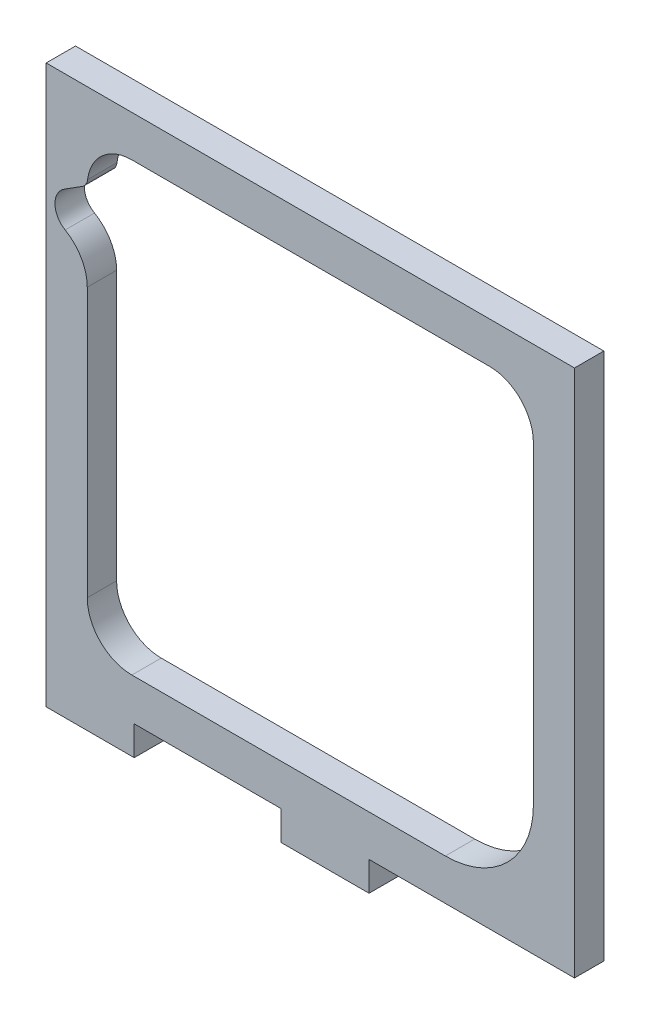
from build123d import *

# Parameters (mm, degrees)
SKETCH1_W           = 114.3
SKETCH1_H           = 114.3
BOSS_EXTRUDE1_DEPTH = 3.175
SKETCH2_W           = 19.05
SKETCH2_H           = 6.35
BOSS_EXTRUDE2_DEPTH = 6.35


with BuildPart() as part:
    # Sketch1 → Boss-Extrude1 (new, symmetric)
    with BuildSketch(Plane.XY):
        Rectangle(SKETCH1_W, SKETCH1_H)
        with BuildLine():
            Line((-38.608, -48.26), (17.087998711, -48.26))
            Line((17.087998711, -48.26), (29.21, -48.26))
            ThreePointArc((29.21, -48.26), (42.680384182, -42.680384182), (48.26, -29.21))
            Line((48.26, -29.21), (48.26, -17.513600374))
            Line((48.26, -17.513600374), (48.26, 38.735))
            ThreePointArc((48.26, 38.735), (45.470192091, 45.470192091), (38.735, 48.26))
            Line((38.735, 48.26), (12.317525133, 48.26))
            Line((12.317525133, 48.26), (-38.608, 48.26))
            ThreePointArc((-38.608, 48.26), (-45.012642843, 45.828917812), (-48.190967175, 39.760321188))
            ThreePointArc((-48.190967175, 39.760321188), (-48.565842226, 38.706298135), (-49.357189106, 37.915560496))
            Line((-49.357189106, 37.915560496), (-53.171784808, 35.50815712))
            ThreePointArc((-53.171784808, 35.50815712), (-55.243349934, 31.674174658), (-53.042175988, 27.913106079))
            ThreePointArc((-53.042175988, 27.913106079), (-49.540481459, 24.38372235), (-48.26, 19.579684328))
            Line((-48.26, 19.579684328), (-48.26, 4.686171691))
            Line((-48.26, 4.686171691), (-48.26, -38.608))
            ThreePointArc((-48.26, -38.608), (-45.432994652, -45.432994652), (-38.608, -48.26))
        make_face(mode=Mode.SUBTRACT)
    extrude(amount=BOSS_EXTRUDE1_DEPTH, both=True)

    # Sketch2 → Boss-Extrude2 (add)
    with BuildSketch(Plane.XZ.offset(57.15)):
        with Locations((3.175, 0)):
            Rectangle(SKETCH2_W, SKETCH2_H)
        with Locations((-47.625, 0)):
            Rectangle(SKETCH2_W, SKETCH2_H)
    extrude(amount=BOSS_EXTRUDE2_DEPTH)


solid = part.part
